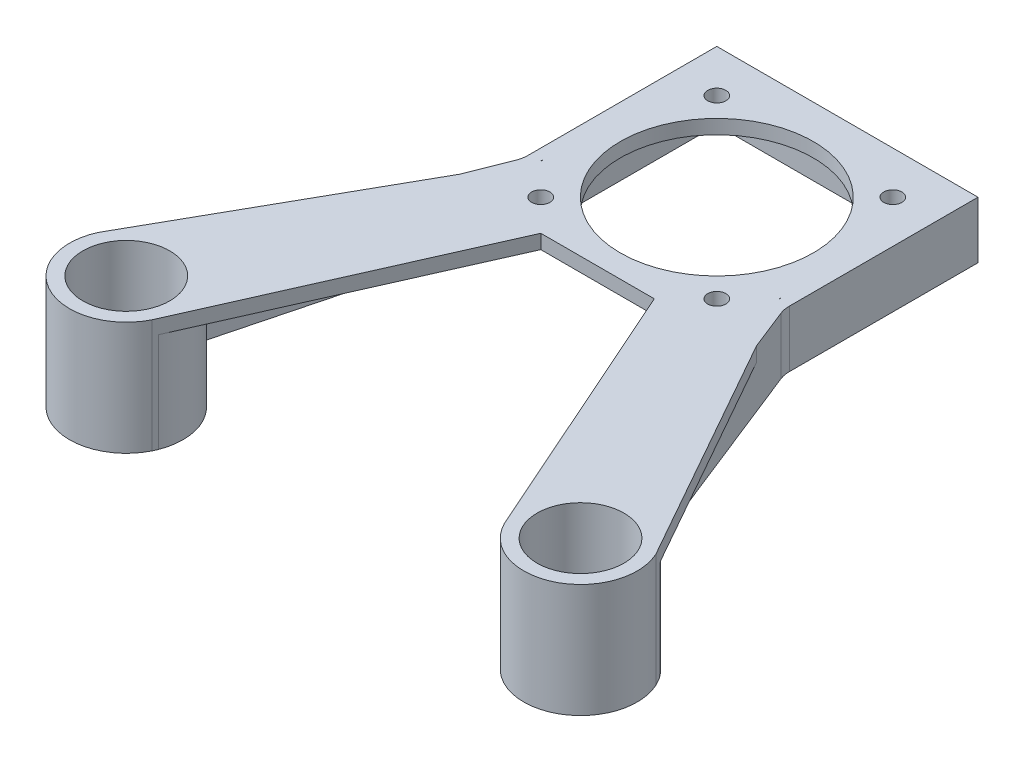
from build123d import *

# Parameters (mm, degrees)
SKETCH_6_W       = 42
SKETCH_6_H       = 42
SKETCH_6_R       = 1.6
SKETCH_6_R_2     = 17
EXTRUDE_1_DEPTH  = 2.5
SKETCH_7_R       = 7.65
EXTRUDE_5_DEPTH  = 2.5
SKETCH_7_7_R     = 7.65
EXTRUDE_7_DEPTH  = 20
SKETCH_7_8_R     = 7.65
EXTRUDE_8_DEPTH  = 20
EXTRUDE_12_DEPTH = 10


with BuildPart() as part:
    # 草图6 → 凸台-拉伸1 (new body)
    with BuildSketch(Plane(origin=(0, 0, 0), x_dir=(1, 0, 0), z_dir=(0, 1, 0))):
        Rectangle(SKETCH_6_W, SKETCH_6_H)
        with Locations((15.5, 15.5)):
            Circle(SKETCH_6_R, mode=Mode.SUBTRACT)
        with Locations((-15.5, 15.5)):
            Circle(SKETCH_6_R, mode=Mode.SUBTRACT)
        with Locations((-15.5, -15.5)):
            Circle(SKETCH_6_R, mode=Mode.SUBTRACT)
        with Locations((15.5, -15.5)):
            Circle(SKETCH_6_R, mode=Mode.SUBTRACT)
        Circle(SKETCH_6_R_2, mode=Mode.SUBTRACT)
    extrude(amount=EXTRUDE_1_DEPTH)

    # 草图7 → 凸台-拉伸5 (add)
    # profile 1 of 2: a face of its own
    with BuildSketch(Plane(origin=(0, 2.5, 0), x_dir=(1, 0, 0), z_dir=(0, 1, 0))):
        with BuildLine():
            Line((-10, -21), (-21, -21))
            Line((-21, -21), (-21, -10))
            Line((-21, -10), (-49.089190248, -59.830273313))
            ThreePointArc((-49.089190248, -59.830273313), (-44.301050518, -73.027788458), (-31.035510623, -68.431470434))
            Line((-31.035510623, -68.431470434), (-10, -21))
        make_face()
        with Locations((-40, -64)):
            Circle(SKETCH_7_R, mode=Mode.SUBTRACT)
    # profile 2 of 2: a face of its own
    with BuildSketch(Plane(origin=(0, 2.5, 0), x_dir=(1, 0, 0), z_dir=(0, 1, 0))):
        with BuildLine():
            Line((21, -10), (21, -21))
            Line((21, -21), (10, -21))
            Line((10, -21), (31.035510623, -68.431470434))
            ThreePointArc((31.035510623, -68.431470434), (44.301050518, -73.027788458), (49.089190248, -59.830273313))
            Line((49.089190248, -59.830273313), (21, -10))
        make_face()
        with Locations((40, -64)):
            Circle(SKETCH_7_R, mode=Mode.SUBTRACT)
    extrude(amount=-EXTRUDE_5_DEPTH)

    # 草图7<7> → 凸台-拉伸7 (add)
    with BuildSketch(Plane(origin=(0, 2.5, 0), x_dir=(1, 0, 0), z_dir=(0, 1, 0))):
        with BuildLine():
            Line((49.089190248, -59.830273313), (48.273152565, -58.382621018))
            ThreePointArc((48.273152565, -58.382621018), (35.328022799, -55.158471341), (30.697682143, -67.669725124))
            Line((30.697682143, -67.669725124), (31.035510623, -68.431470434))
            ThreePointArc((31.035510623, -68.431470434), (42.275423722, -73.737681802), (50, -64))
            ThreePointArc((50, -64), (49.769644376, -61.865978266), (49.089190248, -59.830273313))
        make_face()
        with Locations((40, -64)):
            Circle(SKETCH_7_7_R, mode=Mode.SUBTRACT)
    extrude(amount=-EXTRUDE_7_DEPTH)

    # 草图7<8> → 凸台-拉伸8 (add)
    with BuildSketch(Plane(origin=(0, 2.5, 0), x_dir=(1, 0, 0), z_dir=(0, 1, 0))):
        with BuildLine():
            Line((-31.035510623, -68.431470434), (-30.697682143, -67.669725124))
            ThreePointArc((-30.697682143, -67.669725124), (-30.175968786, -65.867728759), (-30, -64))
            ThreePointArc((-30, -64), (-37.061592749, -54.44145603), (-48.273152565, -58.382621018))
            Line((-48.273152565, -58.382621018), (-49.089190248, -59.830273313))
            ThreePointArc((-49.089190248, -59.830273313), (-44.301050518, -73.027788458), (-31.035510623, -68.431470434))
        make_face()
        with Locations((-40, -64)):
            Circle(SKETCH_7_8_R, mode=Mode.SUBTRACT)
    extrude(amount=-EXTRUDE_8_DEPTH)

    # 草图9 → 凸台-拉伸12 (add)
    with BuildSketch(Plane(origin=(0, 2.5, 0), x_dir=(1, 0, 0), z_dir=(0, 1, 0))):
        with BuildLine():
            Line((0, 23), (-23, 23))
            Line((-23, 23), (-23, -10.22407445))
            ThreePointArc((-23, -10.22407445), (-23.089003749, -11.16328466), (-23.352846327, -12.069057578))
            Line((-23.352846327, -12.069057578), (-40, -54))
            ThreePointArc((-40, -54), (-36.310033743, -54.705692655), (-33.140863903, -56.723170195))
            Line((-33.140863903, -56.723170195), (-21.160706903, -10.618468014))
            ThreePointArc((-21.160706903, -10.618468014), (-21.040339453, -9.994844565), (-21, -9.360993433))
            Line((-21, -9.360993433), (-21, 21))
            Line((-21, 21), (21, 21))
            Line((21, 21), (21, -9.360993433))
            ThreePointArc((21, -9.360993433), (21.040339453, -9.994844565), (21.160706903, -10.618468014))
            Line((21.160706903, -10.618468014), (33.140863903, -56.723170195))
            ThreePointArc((33.140863903, -56.723170195), (36.310033743, -54.705692655), (40, -54))
            Line((40, -54), (23.352846327, -12.069057578))
            ThreePointArc((23.352846327, -12.069057578), (23.089003749, -11.16328466), (23, -10.22407445))
            Line((23, -10.22407445), (23, 23))
            Line((23, 23), (0, 23))
        make_face()
    extrude(amount=-EXTRUDE_12_DEPTH)


solid = part.part
